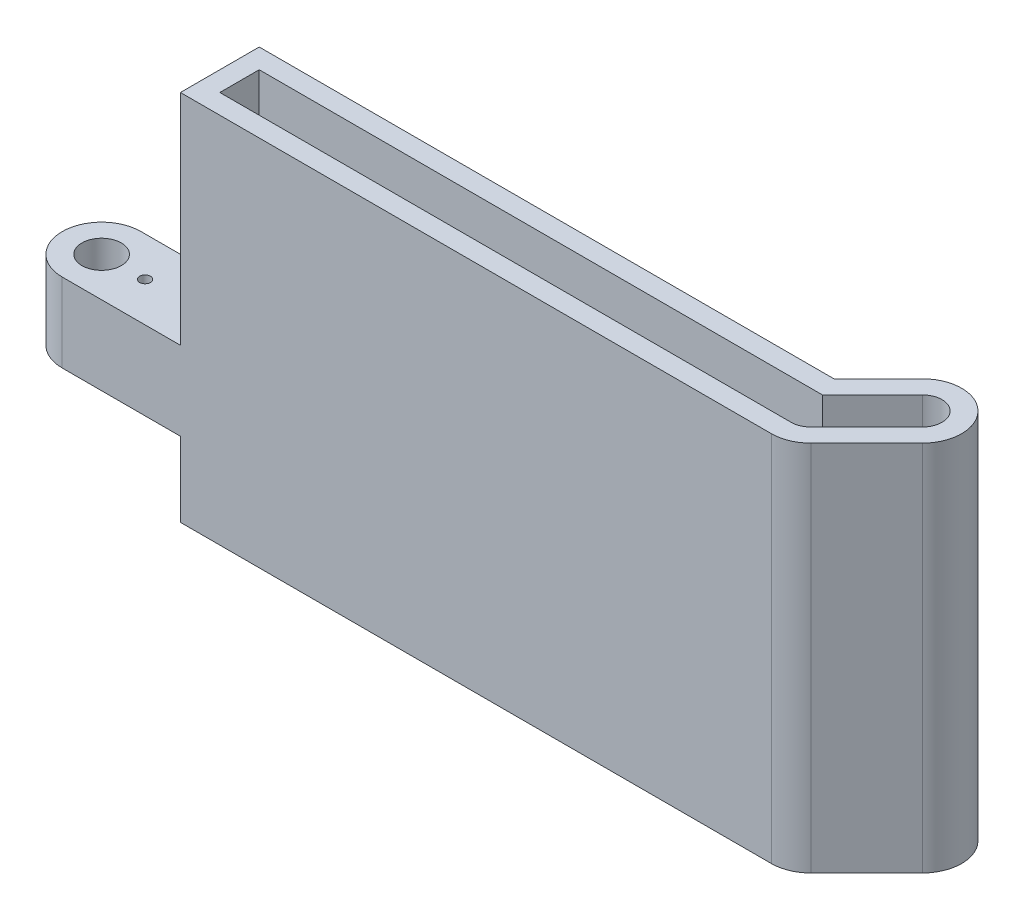
from build123d import *

# Parameters (mm, degrees)
BOSS_EXTRUDE1_DEPTH = 59.999999888
SKETCH2_W           = 25.4
SKETCH2_H           = 12.017000096
SKETCH2_H_2         = 35.282999792
CUT_EXTRUDE1_DEPTH  = 145.478499418
SKETCH3_R           = 0.877000024
CUT_EXTRUDE2_DEPTH  = 140.073319957
SKETCH4_R           = 3.175
CUT_EXTRUDE3_DEPTH  = 140.073319957
CUT_EXTRUDE4_DEPTH  = 144.66286939
FILLET1_R           = 6.35


with BuildPart() as part:
    # Sketch1 → Boss-Extrude1 (new body)
    with BuildSketch(Plane(origin=(0, 0, 0), x_dir=(1, 0, 0), z_dir=(0, 1, 0))):
        with BuildLine():
            Line((111.669743879, 6.35), (0, 6.35))
            ThreePointArc((0, 6.35), (-6.35, 0), (0, -6.35))
            Line((0, -6.35), (114.3, -6.35))
            ThreePointArc((114.3, -6.35), (116.730039796, -5.866635031), (118.790128061, -4.490128061))
            Line((118.790128061, -4.490128061), (127.770384182, 4.490128061))
            ThreePointArc((127.770384182, 4.490128061), (127.770384182, 13.470384182), (118.790128061, 13.470384182))
            Line((118.790128061, 13.470384182), (111.669743879, 6.35))
        make_face()
    extrude(amount=BOSS_EXTRUDE1_DEPTH)

    # Sketch2 → Cut-Extrude1 (cut, through all)
    with BuildSketch(Plane.XY.offset(6.35)):
        with Locations((6.35, 6.008500048)):
            Rectangle(SKETCH2_W, SKETCH2_H)
        with Locations((6.35, 42.358499992)):
            Rectangle(SKETCH2_W, SKETCH2_H_2)
    extrude(amount=-CUT_EXTRUDE1_DEPTH, mode=Mode.SUBTRACT)

    # Sketch3 → Cut-Extrude2 (cut, through all)
    with BuildSketch(Plane.XZ.offset(-12.017000096)):
        with Locations((6.99999997, 0)):
            Circle(SKETCH3_R)
        with Locations((16.000000004, 0)):
            Circle(SKETCH3_R)
    extrude(amount=-CUT_EXTRUDE2_DEPTH, mode=Mode.SUBTRACT)

    # Sketch4 → Cut-Extrude3 (cut, through all)
    with BuildSketch(Plane.XZ.offset(-12.017000096)):
        Circle(SKETCH4_R)
    extrude(amount=-CUT_EXTRUDE3_DEPTH, mode=Mode.SUBTRACT)

    # Sketch5 → Cut-Extrude4 (cut, through all)
    with BuildSketch(Plane(origin=(0, 59.999999888, 0), x_dir=(1, 0, 0), z_dir=(0, 1, 0))):
        with BuildLine():
            Line((22.225, 3.175), (22.225, -3.175))
            Line((22.225, -3.175), (114.3, -3.175))
            ThreePointArc((114.3, -3.175), (115.515019898, -2.933317516), (116.54506403, -2.24506403))
            Line((116.54506403, -2.24506403), (125.525320151, 6.735192091))
            ThreePointArc((125.525320151, 6.735192091), (125.525320151, 11.225320151), (121.035192091, 11.225320151))
            Line((121.035192091, 11.225320151), (112.984871939, 3.175))
            Line((112.984871939, 3.175), (22.225, 3.175))
        make_face()
    extrude(amount=-CUT_EXTRUDE4_DEPTH, mode=Mode.SUBTRACT)

    # Fillet1
    fillet1_edges = [part.edges().sort_by_distance(p)[0] for p in [
        (19.05, 6.008500048, -6.35),
    ]]
    fillet(fillet1_edges, radius=FILLET1_R)


solid = part.part
